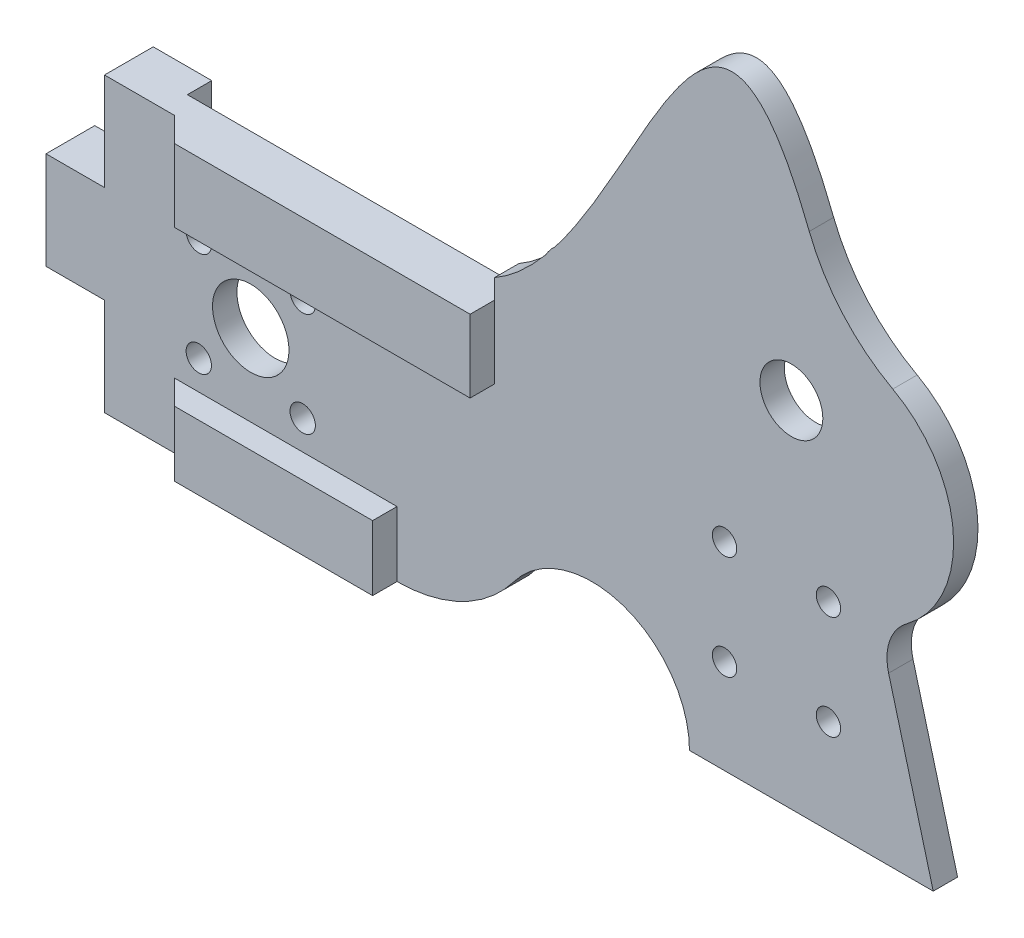
from build123d import *

# Parameters (mm, degrees)
SKETCH1_R           = 1.651
BOSS_EXTRUDE1_DEPTH = 3.175
CUT_EXTRUDE2_DEPTH  = 6.35
SKETCH7_R           = 4.9784
SKETCH7_R_2         = 1.5875
CUT_EXTRUDE3_DEPTH  = 124.96234811
FILLET1_R           = 6.35
SKETCH8_W           = 50.8
SKETCH8_H           = 12.7
CUT_EXTRUDE4_DEPTH  = 50.8
CUT_EXTRUDE5_DEPTH  = 19.304
FILLET6_R           = 6.35
FILLET7_R           = 6.35
FILLET8_R           = 19.05
BOSS_EXTRUDE2_DEPTH = 3.175
FILLET9_R           = 24.13
SKETCH13_W          = 41.667851519
SKETCH13_H          = 9.459584315
SKETCH13_W_2        = 28.967851519
SKETCH13_H_2        = 8.468235606
BOSS_EXTRUDE3_DEPTH = 6.35
SKETCH16_R          = 4.09575
CUT_EXTRUDE8_DEPTH  = 137.155378763
BOSS_EXTRUDE4_DEPTH = 6.35
CUT_EXTRUDE9_DEPTH  = 119.214793194


with BuildPart() as part:
    # Sketch1 → Boss-Extrude1 (new body)
    with BuildSketch(Plane.XY):
        with BuildLine():
            Line((0, 0), (107.95, 0))
            Line((107.95, 0), (100.9362606, 26.175631792))
            Line((100.9362606, 26.175631792), (100.868755024, 26.427566033))
            ThreePointArc((100.868755024, 26.427566033), (110.348359368, 43.438223217), (95.367453293, 55.88))
            Line((95.367453293, 55.88), (0, 38.1))
            Line((0, 38.1), (0, 25.4))
            Line((0, 25.4), (-7.62, 25.4))
            Line((-7.62, 25.4), (-7.62, 12.7))
            Line((-7.62, 12.7), (0, 12.7))
            Line((0, 12.7), (0, 0))
        make_face()
        with Locations((25.817011896, 25.817011896)):
            Circle(SKETCH1_R, mode=Mode.SUBTRACT)
        with Locations((25.817011896, 12.282988104)):
            Circle(SKETCH1_R, mode=Mode.SUBTRACT)
        with Locations((12.282988104, 12.282988104)):
            Circle(SKETCH1_R, mode=Mode.SUBTRACT)
        with Locations((12.282988104, 25.817011896)):
            Circle(SKETCH1_R, mode=Mode.SUBTRACT)
    extrude(amount=BOSS_EXTRUDE1_DEPTH)

    # Sketch6 → Cut-Extrude2 (cut)
    with BuildSketch(Plane.XY.offset(3.175)):
        with BuildLine():
            Line((50.8, 0), (76.2, 0))
            ThreePointArc((76.2, 0), (63.5, 12.7), (50.8, 0))
        make_face()
    extrude(amount=-CUT_EXTRUDE2_DEPTH, mode=Mode.SUBTRACT)

    # Sketch7 → Cut-Extrude3 (cut, through all)
    with BuildSketch(Plane.XY.offset(3.175)):
        with Locations((19.05, 19.05)):
            Circle(SKETCH7_R)
        with Locations((80.766582748, 12.282988104)):
            Circle(SKETCH7_R_2)
        with Locations((94.299702748, 12.282988104)):
            Circle(SKETCH7_R_2)
        with Locations((80.766582748, 25.817011896)):
            Circle(SKETCH7_R_2)
        with Locations((94.299702748, 25.817011896)):
            Circle(SKETCH7_R_2)
    extrude(amount=-CUT_EXTRUDE3_DEPTH, mode=Mode.SUBTRACT)

    # Fillet1
    fillet1_edges = [part.edges().sort_by_distance(p)[0] for p in [
        (100.868755024, 26.427566033, 1.5875),
    ]]
    fillet(fillet1_edges, radius=FILLET1_R)

    # Sketch8 → Cut-Extrude4 (cut)
    with BuildSketch(Plane.XY.offset(3.175)):
        with Locations((25.4, 44.45)):
            Rectangle(SKETCH8_W, SKETCH8_H)
    extrude(amount=-CUT_EXTRUDE4_DEPTH, mode=Mode.SUBTRACT)

    # Sketch9 → Cut-Extrude5 (cut)
    with BuildSketch(Plane.XY.offset(3.175)):
        Polygon((50.8, 47.57098794), (50.8, 40.64), (57.15, 40.64), (57.15, 48.754861432), align=None)
    extrude(amount=-CUT_EXTRUDE5_DEPTH, mode=Mode.SUBTRACT)

    # Fillet6
    fillet6_edges = [part.edges().sort_by_distance(p)[0] for p in [
        (57.15, 40.64, 1.5875),
    ]]
    fillet(fillet6_edges, radius=FILLET6_R - 0.0001)  # a hair under: the kernel refuses the full size

    # Fillet7
    fillet7_edges = [part.edges().sort_by_distance(p)[0] for p in [
        (57.15, 48.754861432, 1.5875),
    ]]
    fillet(fillet7_edges, radius=FILLET7_R)

    # Fillet8
    fillet8_edges = [part.edges().sort_by_distance(p)[0] for p in [
        (50.8, 0, 1.5875),
    ]]
    fillet(fillet8_edges, radius=FILLET8_R)

    # Sketch12 → Boss-Extrude2 (add)
    with BuildSketch(Plane.XY.offset(3.175)):
        with BuildLine():
            Line((50.8, 40.64), (85.027112904, 40.64))
            Line((85.027112904, 40.64), (95.367453293, 55.88))
            add(Edge.make_bspline(
                [(50.8, 40.64), (70.777788932, 52.178803671), (78.594281742, 111.543427795), (95.367453293, 55.88)],
                knots=[0, 0, 0, 0, 1, 1, 1, 1], degree=3))
        make_face()
    extrude(amount=-BOSS_EXTRUDE2_DEPTH)

    # Fillet9
    fillet9_edges = [part.edges().sort_by_distance(p)[0] for p in [
        (95.367453293, 55.88, 1.5875),
    ]]
    fillet(fillet9_edges, radius=FILLET9_R)

    # Sketch13 → Boss-Extrude3 (add)
    with BuildSketch(Plane(origin=(0, 0, 0), x_dir=(-1, 0, 0), z_dir=(0, 0, -1))):
        with Locations((-29.966074241, 33.370207843)):
            Rectangle(SKETCH13_W, SKETCH13_H)
        with Locations((-23.616074241, 4.234117803)):
            Rectangle(SKETCH13_W_2, SKETCH13_H_2)
    extrude(amount=-BOSS_EXTRUDE3_DEPTH)

    # Sketch16 → Cut-Extrude8 (cut, through all)
    with BuildSketch(Plane.XY.offset(3.175)):
        with Locations((89.473702748, 46.137011896)):
            Circle(SKETCH16_R)
    extrude(amount=-CUT_EXTRUDE8_DEPTH, mode=Mode.SUBTRACT)

    # Sketch18 → Boss-Extrude4 (add)
    with BuildSketch(Plane.XY.offset(3.175)):
        Polygon((0, 0), (7.62, 0), (7.62, 38.1), (0, 38.1), (0, 25.4), (-7.62, 25.4), (-7.62, 12.7), (0, 12.7), align=None)
    extrude(amount=-BOSS_EXTRUDE4_DEPTH)

    # Sketch19 → Cut-Extrude9 (cut, through all)
    with BuildSketch(Plane(origin=(0, 38.1, 0), x_dir=(1, 0, 0), z_dir=(0, 1, 0))):
        Polygon((9.132148481, -3.175), (12.307148481, -6.35), (9.132148481, -6.35), align=None)
    extrude(amount=-CUT_EXTRUDE9_DEPTH, mode=Mode.SUBTRACT)


solid = part.part
